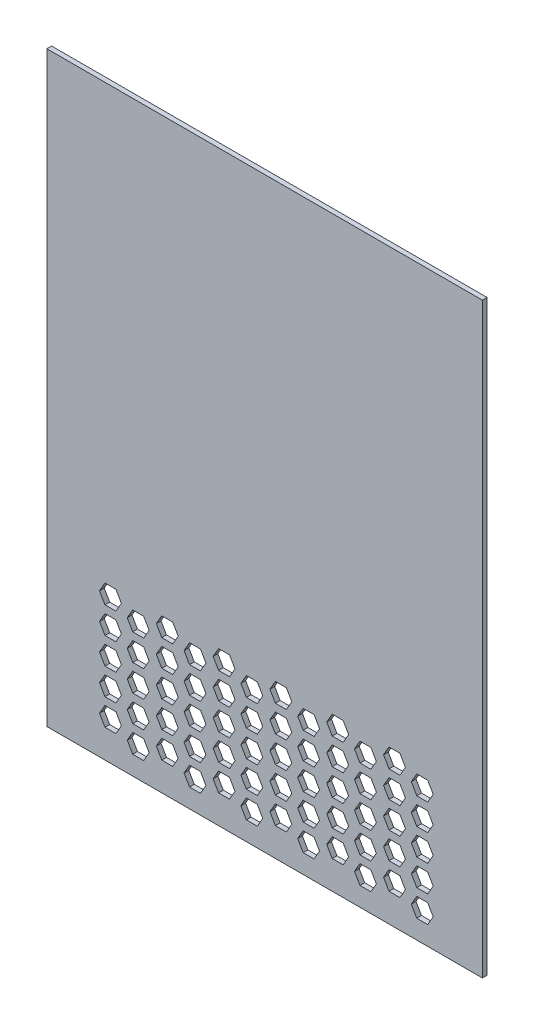
from build123d import *

# Parameters (mm, degrees)
SKETCH1_W           = 146.05
SKETCH1_H           = 196.85
BOSS_EXTRUDE1_DEPTH = 1.5875
CUT_EXTRUDE1_DEPTH  = 246.118430878


with BuildPart() as part:
    # Sketch1 → Boss-Extrude1 (new body)
    with BuildSketch(Plane.XY):
        with Locations((73.025, 98.425)):
            Rectangle(SKETCH1_W, SKETCH1_H)
    extrude(amount=BOSS_EXTRUDE1_DEPTH)

    # Sketch2 → Cut-Extrude1 (cut, through all)
    with BuildSketch(Plane(origin=(0, 0, 0), x_dir=(-1, 0, 0), z_dir=(0, 0, -1))):
        Polygon((-122.207651581, 9.525), (-124.040738686, 12.7), (-127.706912895, 12.7), (-129.54, 9.525), (-127.706912895, 6.35), (-124.040738686, 6.35), align=None)
        Polygon((-112.898390267, 12.7), (-114.731477372, 15.875), (-118.397651581, 15.875), (-120.230738686, 12.7), (-118.397651581, 9.525), (-114.731477372, 9.525), align=None)
        Polygon((-103.157651581, 9.525), (-104.990738686, 12.7), (-108.656912895, 12.7), (-110.49, 9.525), (-108.656912895, 6.35), (-104.990738686, 6.35), align=None)
        Polygon((-93.848390267, 12.7), (-95.681477372, 15.875), (-99.347651581, 15.875), (-101.180738686, 12.7), (-99.347651581, 9.525), (-95.681477372, 9.525), align=None)
        Polygon((-84.107651581, 9.525), (-85.940738686, 12.7), (-89.606912895, 12.7), (-91.44, 9.525), (-89.606912895, 6.35), (-85.940738686, 6.35), align=None)
        Polygon((-74.798390267, 12.7), (-76.631477372, 15.875), (-80.297651581, 15.875), (-82.130738686, 12.7), (-80.297651581, 9.525), (-76.631477372, 9.525), align=None)
        Polygon((-65.057651581, 9.525), (-66.890738686, 12.7), (-70.556912895, 12.7), (-72.39, 9.525), (-70.556912895, 6.35), (-66.890738686, 6.35), align=None)
        Polygon((-55.748390267, 12.7), (-57.581477372, 15.875), (-61.247651581, 15.875), (-63.080738686, 12.7), (-61.247651581, 9.525), (-57.581477372, 9.525), align=None)
        Polygon((-46.007651581, 9.525), (-47.840738686, 12.7), (-51.506912895, 12.7), (-53.34, 9.525), (-51.506912895, 6.35), (-47.840738686, 6.35), align=None)
        Polygon((-36.698390267, 12.7), (-38.531477372, 15.875), (-42.197651581, 15.875), (-44.030738686, 12.7), (-42.197651581, 9.525), (-38.531477372, 9.525), align=None)
        Polygon((-26.957651581, 9.525), (-28.790738686, 12.7), (-32.456912895, 12.7), (-34.29, 9.525), (-32.456912895, 6.35), (-28.790738686, 6.35), align=None)
        Polygon((-17.648390267, 12.7), (-19.481477372, 15.875), (-23.147651581, 15.875), (-24.980738686, 12.7), (-23.147651581, 9.525), (-19.481477372, 9.525), align=None)
        Polygon((-103.157651581, 18.415), (-104.990738686, 21.59), (-108.656912895, 21.59), (-110.49, 18.415), (-108.656912895, 15.24), (-104.990738686, 15.24), align=None)
        Polygon((-93.848390267, 21.59), (-95.681477372, 24.765), (-99.347651581, 24.765), (-101.180738686, 21.59), (-99.347651581, 18.415), (-95.681477372, 18.415), align=None)
        Polygon((-84.107651581, 18.415), (-85.940738686, 21.59), (-89.606912895, 21.59), (-91.44, 18.415), (-89.606912895, 15.24), (-85.940738686, 15.24), align=None)
        Polygon((-74.798390267, 21.59), (-76.631477372, 24.765), (-80.297651581, 24.765), (-82.130738686, 21.59), (-80.297651581, 18.415), (-76.631477372, 18.415), align=None)
        Polygon((-65.057651581, 18.415), (-66.890738686, 21.59), (-70.556912895, 21.59), (-72.39, 18.415), (-70.556912895, 15.24), (-66.890738686, 15.24), align=None)
        Polygon((-55.748390267, 21.59), (-57.581477372, 24.765), (-61.247651581, 24.765), (-63.080738686, 21.59), (-61.247651581, 18.415), (-57.581477372, 18.415), align=None)
        Polygon((-46.007651581, 18.415), (-47.840738686, 21.59), (-51.506912895, 21.59), (-53.34, 18.415), (-51.506912895, 15.24), (-47.840738686, 15.24), align=None)
        Polygon((-36.698390267, 21.59), (-38.531477372, 24.765), (-42.197651581, 24.765), (-44.030738686, 21.59), (-42.197651581, 18.415), (-38.531477372, 18.415), align=None)
        Polygon((-26.957651581, 18.415), (-28.790738686, 21.59), (-32.456912895, 21.59), (-34.29, 18.415), (-32.456912895, 15.24), (-28.790738686, 15.24), align=None)
        Polygon((-17.648390267, 21.59), (-19.481477372, 24.765), (-23.147651581, 24.765), (-24.980738686, 21.59), (-23.147651581, 18.415), (-19.481477372, 18.415), align=None)
        Polygon((-103.157651581, 27.305), (-104.990738686, 30.48), (-108.656912895, 30.48), (-110.49, 27.305), (-108.656912895, 24.13), (-104.990738686, 24.13), align=None)
        Polygon((-93.848390267, 30.48), (-95.681477372, 33.655), (-99.347651581, 33.655), (-101.180738686, 30.48), (-99.347651581, 27.305), (-95.681477372, 27.305), align=None)
        Polygon((-84.107651581, 27.305), (-85.940738686, 30.48), (-89.606912895, 30.48), (-91.44, 27.305), (-89.606912895, 24.13), (-85.940738686, 24.13), align=None)
        Polygon((-74.798390267, 30.48), (-76.631477372, 33.655), (-80.297651581, 33.655), (-82.130738686, 30.48), (-80.297651581, 27.305), (-76.631477372, 27.305), align=None)
        Polygon((-65.057651581, 27.305), (-66.890738686, 30.48), (-70.556912895, 30.48), (-72.39, 27.305), (-70.556912895, 24.13), (-66.890738686, 24.13), align=None)
        Polygon((-55.748390267, 30.48), (-57.581477372, 33.655), (-61.247651581, 33.655), (-63.080738686, 30.48), (-61.247651581, 27.305), (-57.581477372, 27.305), align=None)
        Polygon((-46.007651581, 27.305), (-47.840738686, 30.48), (-51.506912895, 30.48), (-53.34, 27.305), (-51.506912895, 24.13), (-47.840738686, 24.13), align=None)
        Polygon((-36.698390267, 30.48), (-38.531477372, 33.655), (-42.197651581, 33.655), (-44.030738686, 30.48), (-42.197651581, 27.305), (-38.531477372, 27.305), align=None)
        Polygon((-26.957651581, 27.305), (-28.790738686, 30.48), (-32.456912895, 30.48), (-34.29, 27.305), (-32.456912895, 24.13), (-28.790738686, 24.13), align=None)
        Polygon((-17.648390267, 30.48), (-19.481477372, 33.655), (-23.147651581, 33.655), (-24.980738686, 30.48), (-23.147651581, 27.305), (-19.481477372, 27.305), align=None)
        Polygon((-103.157651581, 36.195), (-104.990738686, 39.37), (-108.656912895, 39.37), (-110.49, 36.195), (-108.656912895, 33.02), (-104.990738686, 33.02), align=None)
        Polygon((-93.848390267, 39.37), (-95.681477372, 42.545), (-99.347651581, 42.545), (-101.180738686, 39.37), (-99.347651581, 36.195), (-95.681477372, 36.195), align=None)
        Polygon((-84.107651581, 36.195), (-85.940738686, 39.37), (-89.606912895, 39.37), (-91.44, 36.195), (-89.606912895, 33.02), (-85.940738686, 33.02), align=None)
        Polygon((-74.798390267, 39.37), (-76.631477372, 42.545), (-80.297651581, 42.545), (-82.130738686, 39.37), (-80.297651581, 36.195), (-76.631477372, 36.195), align=None)
        Polygon((-65.057651581, 36.195), (-66.890738686, 39.37), (-70.556912895, 39.37), (-72.39, 36.195), (-70.556912895, 33.02), (-66.890738686, 33.02), align=None)
        Polygon((-55.748390267, 39.37), (-57.581477372, 42.545), (-61.247651581, 42.545), (-63.080738686, 39.37), (-61.247651581, 36.195), (-57.581477372, 36.195), align=None)
        Polygon((-46.007651581, 36.195), (-47.840738686, 39.37), (-51.506912895, 39.37), (-53.34, 36.195), (-51.506912895, 33.02), (-47.840738686, 33.02), align=None)
        Polygon((-36.698390267, 39.37), (-38.531477372, 42.545), (-42.197651581, 42.545), (-44.030738686, 39.37), (-42.197651581, 36.195), (-38.531477372, 36.195), align=None)
        Polygon((-26.957651581, 36.195), (-28.790738686, 39.37), (-32.456912895, 39.37), (-34.29, 36.195), (-32.456912895, 33.02), (-28.790738686, 33.02), align=None)
        Polygon((-17.648390267, 39.37), (-19.481477372, 42.545), (-23.147651581, 42.545), (-24.980738686, 39.37), (-23.147651581, 36.195), (-19.481477372, 36.195), align=None)
        Polygon((-103.157651581, 45.085), (-104.990738686, 48.26), (-108.656912895, 48.26), (-110.49, 45.085), (-108.656912895, 41.91), (-104.990738686, 41.91), align=None)
        Polygon((-93.848390267, 48.26), (-95.681477372, 51.435), (-99.347651581, 51.435), (-101.180738686, 48.26), (-99.347651581, 45.085), (-95.681477372, 45.085), align=None)
        Polygon((-84.107651581, 45.085), (-85.940738686, 48.26), (-89.606912895, 48.26), (-91.44, 45.085), (-89.606912895, 41.91), (-85.940738686, 41.91), align=None)
        Polygon((-74.798390267, 48.26), (-76.631477372, 51.435), (-80.297651581, 51.435), (-82.130738686, 48.26), (-80.297651581, 45.085), (-76.631477372, 45.085), align=None)
        Polygon((-65.057651581, 45.085), (-66.890738686, 48.26), (-70.556912895, 48.26), (-72.39, 45.085), (-70.556912895, 41.91), (-66.890738686, 41.91), align=None)
        Polygon((-55.748390267, 48.26), (-57.581477372, 51.435), (-61.247651581, 51.435), (-63.080738686, 48.26), (-61.247651581, 45.085), (-57.581477372, 45.085), align=None)
        Polygon((-46.007651581, 45.085), (-47.840738686, 48.26), (-51.506912895, 48.26), (-53.34, 45.085), (-51.506912895, 41.91), (-47.840738686, 41.91), align=None)
        Polygon((-36.698390267, 48.26), (-38.531477372, 51.435), (-42.197651581, 51.435), (-44.030738686, 48.26), (-42.197651581, 45.085), (-38.531477372, 45.085), align=None)
        Polygon((-26.957651581, 45.085), (-28.790738686, 48.26), (-32.456912895, 48.26), (-34.29, 45.085), (-32.456912895, 41.91), (-28.790738686, 41.91), align=None)
        Polygon((-17.648390267, 48.26), (-19.481477372, 51.435), (-23.147651581, 51.435), (-24.980738686, 48.26), (-23.147651581, 45.085), (-19.481477372, 45.085), align=None)
        Polygon((-122.207651581, 18.415), (-124.040738686, 21.59), (-127.706912895, 21.59), (-129.54, 18.415), (-127.706912895, 15.24), (-124.040738686, 15.24), align=None)
        Polygon((-112.898390267, 21.59), (-114.731477372, 24.765), (-118.397651581, 24.765), (-120.230738686, 21.59), (-118.397651581, 18.415), (-114.731477372, 18.415), align=None)
        Polygon((-122.207651581, 27.305), (-124.040738686, 30.48), (-127.706912895, 30.48), (-129.54, 27.305), (-127.706912895, 24.13), (-124.040738686, 24.13), align=None)
        Polygon((-112.898390267, 30.48), (-114.731477372, 33.655), (-118.397651581, 33.655), (-120.230738686, 30.48), (-118.397651581, 27.305), (-114.731477372, 27.305), align=None)
        Polygon((-122.207651581, 36.195), (-124.040738686, 39.37), (-127.706912895, 39.37), (-129.54, 36.195), (-127.706912895, 33.02), (-124.040738686, 33.02), align=None)
        Polygon((-112.898390267, 39.37), (-114.731477372, 42.545), (-118.397651581, 42.545), (-120.230738686, 39.37), (-118.397651581, 36.195), (-114.731477372, 36.195), align=None)
        Polygon((-122.207651581, 45.085), (-124.040738686, 48.26), (-127.706912895, 48.26), (-129.54, 45.085), (-127.706912895, 41.91), (-124.040738686, 41.91), align=None)
        Polygon((-112.898390267, 48.26), (-114.731477372, 51.435), (-118.397651581, 51.435), (-120.230738686, 48.26), (-118.397651581, 45.085), (-114.731477372, 45.085), align=None)
    extrude(amount=-CUT_EXTRUDE1_DEPTH, mode=Mode.SUBTRACT)


solid = part.part
